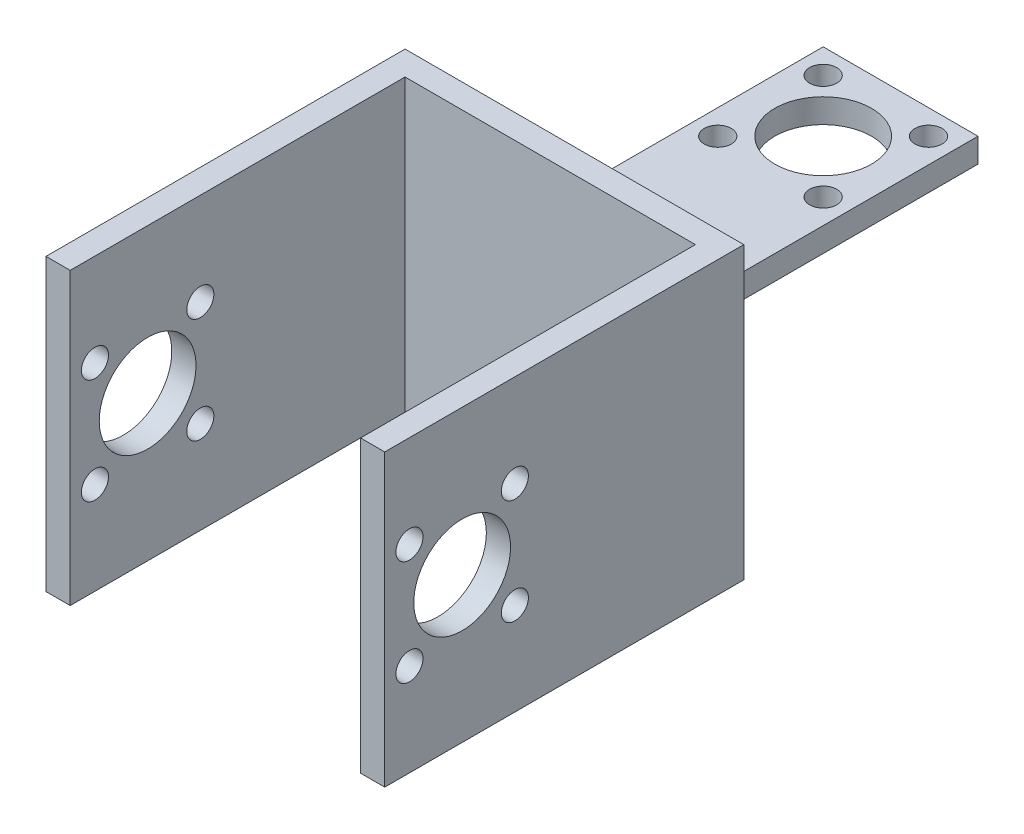
from build123d import *

# Parameters (mm, degrees)
BOSS_EXTRUDE1_DEPTH = 19.05
SKETCH3_W           = 20.32
SKETCH3_H           = 43.561
CUT_EXTRUDE1_DEPTH  = 19.05
SKETCH4_W           = 20.32
SKETCH4_H           = 43.561
CUT_EXTRUDE2_DEPTH  = 15.875
CUT_EXTRUDE3_REACH  = 100.572
SKETCH6_R           = 6.35
SKETCH6_R_2         = 1.778
CUT_EXTRUDE6_REACH  = 104.768
SKETCH9_R           = 6.35
SKETCH9_R_2         = 1.778
CUT_EXTRUDE7_REACH  = 104.768
SKETCH10_R          = 6.35
SKETCH10_R_2        = 1.778


with BuildPart() as part:
    # Sketch1 → Boss-Extrude1 (new, symmetric)
    with BuildSketch(Plane(origin=(0, 0, 0), x_dir=(1, 0, 0), z_dir=(0, 1, 0))):
        Polygon((0, 0), (-20.32, 0), (-20.32, -43.561), (-31.623, -43.561), (-31.623, -90.678), (-28.448, -90.678), (-28.448, -46.736), (9.652, -46.736), (9.652, -90.678), (12.827, -90.678), (12.827, -43.561), (0, -43.561), align=None)
    extrude(amount=BOSS_EXTRUDE1_DEPTH, both=True)

    # Sketch3 → Cut-Extrude1 (cut)
    with BuildSketch(Plane.XZ.offset(19.05)):
        with Locations((-10.16, 21.7805)):
            Rectangle(SKETCH3_W, SKETCH3_H)
    extrude(amount=-CUT_EXTRUDE1_DEPTH, mode=Mode.SUBTRACT)

    # Sketch4 → Cut-Extrude2 (cut)
    with BuildSketch(Plane(origin=(0, 19.05, 0), x_dir=(1, 0, 0), z_dir=(0, 1, 0))):
        with Locations((-10.16, -21.7805)):
            Rectangle(SKETCH4_W, SKETCH4_H)
    extrude(amount=-CUT_EXTRUDE2_DEPTH, mode=Mode.SUBTRACT)

    # Sketch6 → Cut-Extrude3 (cut, up to next)
    with BuildSketch(Plane(origin=(0, 3.175, 0), x_dir=(1, 0, 0), z_dir=(0, 1, 0)), mode=Mode.PRIVATE) as cut_extrude3_sk1:
        with Locations((-10.16, -10.16)):
            Circle(SKETCH6_R)
    cut_extrude3_tool1 = extrude(cut_extrude3_sk1.sketch, amount=-CUT_EXTRUDE3_REACH, mode=Mode.PRIVATE) & part.part
    # Sketch6 → Cut-Extrude3 (cut, up to next)
    with BuildSketch(Plane(origin=(0, 3.175, 0), x_dir=(1, 0, 0), z_dir=(0, 1, 0)), mode=Mode.PRIVATE) as cut_extrude3_sk2:
        with Locations((-17.074797213, -17.074797213)):
            Circle(SKETCH6_R_2)
    cut_extrude3_tool2 = extrude(cut_extrude3_sk2.sketch, amount=-CUT_EXTRUDE3_REACH, mode=Mode.PRIVATE) & part.part
    # Sketch6 → Cut-Extrude3 (cut, up to next)
    with BuildSketch(Plane(origin=(0, 3.175, 0), x_dir=(1, 0, 0), z_dir=(0, 1, 0)), mode=Mode.PRIVATE) as cut_extrude3_sk3:
        with Locations((-17.074797213, -3.245202787)):
            Circle(SKETCH6_R_2)
    cut_extrude3_tool3 = extrude(cut_extrude3_sk3.sketch, amount=-CUT_EXTRUDE3_REACH, mode=Mode.PRIVATE) & part.part
    # Sketch6 → Cut-Extrude3 (cut, up to next)
    with BuildSketch(Plane(origin=(0, 3.175, 0), x_dir=(1, 0, 0), z_dir=(0, 1, 0)), mode=Mode.PRIVATE) as cut_extrude3_sk4:
        with Locations((-3.245202787, -3.245202787)):
            Circle(SKETCH6_R_2)
    cut_extrude3_tool4 = extrude(cut_extrude3_sk4.sketch, amount=-CUT_EXTRUDE3_REACH, mode=Mode.PRIVATE) & part.part
    # Sketch6 → Cut-Extrude3 (cut, up to next)
    with BuildSketch(Plane(origin=(0, 3.175, 0), x_dir=(1, 0, 0), z_dir=(0, 1, 0)), mode=Mode.PRIVATE) as cut_extrude3_sk5:
        with Locations((-3.245202787, -17.074797213)):
            Circle(SKETCH6_R_2)
    cut_extrude3_tool5 = extrude(cut_extrude3_sk5.sketch, amount=-CUT_EXTRUDE3_REACH, mode=Mode.PRIVATE) & part.part
    add(cut_extrude3_tool1.solids().sort_by_distance((-10.16, 3.175, 10.16))[0], mode=Mode.SUBTRACT)
    add(cut_extrude3_tool2.solids().sort_by_distance((-17.074797, 3.175, 17.074797))[0], mode=Mode.SUBTRACT)
    add(cut_extrude3_tool3.solids().sort_by_distance((-17.074797, 3.175, 3.245203))[0], mode=Mode.SUBTRACT)
    add(cut_extrude3_tool4.solids().sort_by_distance((-3.245203, 3.175, 3.245203))[0], mode=Mode.SUBTRACT)
    add(cut_extrude3_tool5.solids().sort_by_distance((-3.245203, 3.175, 17.074797))[0], mode=Mode.SUBTRACT)

    # Sketch9 → Cut-Extrude6 (cut, up to next)
    with BuildSketch(Plane(origin=(12.827, 0, 0), x_dir=(0, 0, -1), z_dir=(1, 0, 0)), mode=Mode.PRIVATE) as cut_extrude6_sk1:
        with Locations((-80.518, 0)):
            Circle(SKETCH9_R)
    cut_extrude6_tool1 = extrude(cut_extrude6_sk1.sketch, amount=-CUT_EXTRUDE6_REACH, mode=Mode.PRIVATE) & part.part
    # Sketch9 → Cut-Extrude6 (cut, up to next)
    with BuildSketch(Plane(origin=(12.827, 0, 0), x_dir=(0, 0, -1), z_dir=(1, 0, 0)), mode=Mode.PRIVATE) as cut_extrude6_sk2:
        with Locations((-87.432797213, 6.914797213)):
            Circle(SKETCH9_R_2)
    cut_extrude6_tool2 = extrude(cut_extrude6_sk2.sketch, amount=-CUT_EXTRUDE6_REACH, mode=Mode.PRIVATE) & part.part
    # Sketch9 → Cut-Extrude6 (cut, up to next)
    with BuildSketch(Plane(origin=(12.827, 0, 0), x_dir=(0, 0, -1), z_dir=(1, 0, 0)), mode=Mode.PRIVATE) as cut_extrude6_sk3:
        with Locations((-73.603202787, 6.914797213)):
            Circle(SKETCH9_R_2)
    cut_extrude6_tool3 = extrude(cut_extrude6_sk3.sketch, amount=-CUT_EXTRUDE6_REACH, mode=Mode.PRIVATE) & part.part
    # Sketch9 → Cut-Extrude6 (cut, up to next)
    with BuildSketch(Plane(origin=(12.827, 0, 0), x_dir=(0, 0, -1), z_dir=(1, 0, 0)), mode=Mode.PRIVATE) as cut_extrude6_sk4:
        with Locations((-73.603202787, -6.914797213)):
            Circle(SKETCH9_R_2)
    cut_extrude6_tool4 = extrude(cut_extrude6_sk4.sketch, amount=-CUT_EXTRUDE6_REACH, mode=Mode.PRIVATE) & part.part
    # Sketch9 → Cut-Extrude6 (cut, up to next)
    with BuildSketch(Plane(origin=(12.827, 0, 0), x_dir=(0, 0, -1), z_dir=(1, 0, 0)), mode=Mode.PRIVATE) as cut_extrude6_sk5:
        with Locations((-87.432797213, -6.914797213)):
            Circle(SKETCH9_R_2)
    cut_extrude6_tool5 = extrude(cut_extrude6_sk5.sketch, amount=-CUT_EXTRUDE6_REACH, mode=Mode.PRIVATE) & part.part
    add(cut_extrude6_tool1.solids().sort_by_distance((12.827, 0, 80.518))[0], mode=Mode.SUBTRACT)
    add(cut_extrude6_tool2.solids().sort_by_distance((12.827, 6.914797, 87.432797))[0], mode=Mode.SUBTRACT)
    add(cut_extrude6_tool3.solids().sort_by_distance((12.827, 6.914797, 73.603203))[0], mode=Mode.SUBTRACT)
    add(cut_extrude6_tool4.solids().sort_by_distance((12.827, -6.914797, 73.603203))[0], mode=Mode.SUBTRACT)
    add(cut_extrude6_tool5.solids().sort_by_distance((12.827, -6.914797, 87.432797))[0], mode=Mode.SUBTRACT)

    # Sketch10 → Cut-Extrude7 (cut, up to next)
    with BuildSketch(Plane.ZY.offset(31.623), mode=Mode.PRIVATE) as cut_extrude7_sk1:
        with Locations((80.518, 0)):
            Circle(SKETCH10_R)
    cut_extrude7_tool1 = extrude(cut_extrude7_sk1.sketch, amount=-CUT_EXTRUDE7_REACH, mode=Mode.PRIVATE) & part.part
    # Sketch10 → Cut-Extrude7 (cut, up to next)
    with BuildSketch(Plane.ZY.offset(31.623), mode=Mode.PRIVATE) as cut_extrude7_sk2:
        with Locations((73.603202787, 6.914797213)):
            Circle(SKETCH10_R_2)
    cut_extrude7_tool2 = extrude(cut_extrude7_sk2.sketch, amount=-CUT_EXTRUDE7_REACH, mode=Mode.PRIVATE) & part.part
    # Sketch10 → Cut-Extrude7 (cut, up to next)
    with BuildSketch(Plane.ZY.offset(31.623), mode=Mode.PRIVATE) as cut_extrude7_sk3:
        with Locations((87.432797213, 6.914797213)):
            Circle(SKETCH10_R_2)
    cut_extrude7_tool3 = extrude(cut_extrude7_sk3.sketch, amount=-CUT_EXTRUDE7_REACH, mode=Mode.PRIVATE) & part.part
    # Sketch10 → Cut-Extrude7 (cut, up to next)
    with BuildSketch(Plane.ZY.offset(31.623), mode=Mode.PRIVATE) as cut_extrude7_sk4:
        with Locations((87.432797213, -6.914797213)):
            Circle(SKETCH10_R_2)
    cut_extrude7_tool4 = extrude(cut_extrude7_sk4.sketch, amount=-CUT_EXTRUDE7_REACH, mode=Mode.PRIVATE) & part.part
    # Sketch10 → Cut-Extrude7 (cut, up to next)
    with BuildSketch(Plane.ZY.offset(31.623), mode=Mode.PRIVATE) as cut_extrude7_sk5:
        with Locations((73.603202787, -6.914797213)):
            Circle(SKETCH10_R_2)
    cut_extrude7_tool5 = extrude(cut_extrude7_sk5.sketch, amount=-CUT_EXTRUDE7_REACH, mode=Mode.PRIVATE) & part.part
    add(cut_extrude7_tool1.solids().sort_by_distance((-31.623, 0, 80.518))[0], mode=Mode.SUBTRACT)
    add(cut_extrude7_tool2.solids().sort_by_distance((-31.623, 6.914797, 73.603203))[0], mode=Mode.SUBTRACT)
    add(cut_extrude7_tool3.solids().sort_by_distance((-31.623, 6.914797, 87.432797))[0], mode=Mode.SUBTRACT)
    add(cut_extrude7_tool4.solids().sort_by_distance((-31.623, -6.914797, 87.432797))[0], mode=Mode.SUBTRACT)
    add(cut_extrude7_tool5.solids().sort_by_distance((-31.623, -6.914797, 73.603203))[0], mode=Mode.SUBTRACT)


solid = part.part
